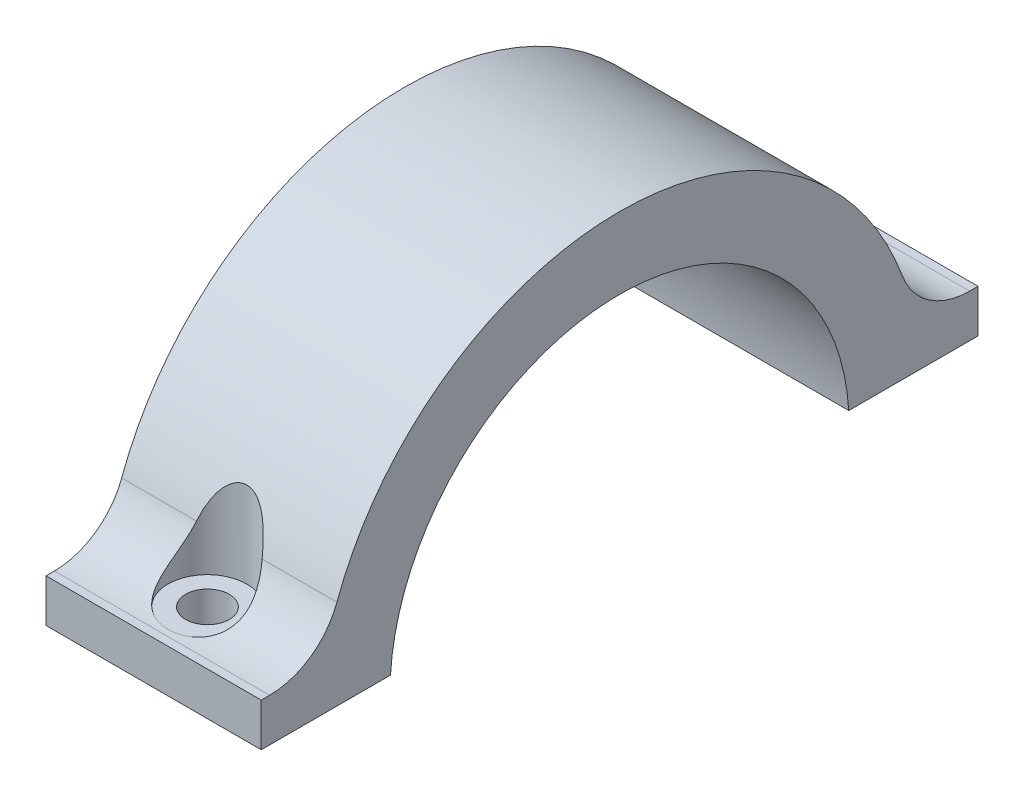
from build123d import *

# Parameters (mm, degrees)
BOSS_EXTRUDE1_DEPTH = 15
FILLET1_R           = 5
SKETCH2_R           = 2.75
CUT_EXTRUDE1_DEPTH  = 34.73143068
CUT_EXTRUDE2_DEPTH  = 34.731430775


# Read off the part's stored shape, not the designer's step: Mirror1
with BuildPart() as part:
    # Sketch1 → Boss-Extrude1 (new body)
    with BuildSketch(Plane(origin=(0, 0, 0), x_dir=(0, 0, -1), z_dir=(1, 0, 0))):
        with BuildLine():
            ThreePointArc((-20.976176963, 1), (-14.491376746, 15.198684154), (0, 21))
            Line((0, 21), (0, 16))
            ThreePointArc((0, 16), (-10.95445115, 11.66190379), (-15.968719423, 1))
            Line((-15.968719423, 1), (-20.976176963, 1))
        make_face()
        with BuildLine():
            Line((-24.976176963, 1), (-20.976176963, 1))
            ThreePointArc((-20.976176963, 1), (-20.84987969, 2.506494942), (-20.615528128, 4))
            Line((-20.615528128, 4), (-24.976176963, 4))
            Line((-24.976176963, 4), (-24.976176963, 1))
        make_face()
    extrude(amount=BOSS_EXTRUDE1_DEPTH)

    # Fillet1
    fillet1_edges = [part.edges().sort_by_distance(p)[0] for p in [
        (7.5, 4, 20.615528128),
    ]]
    fillet(fillet1_edges, radius=FILLET1_R)

    # Sketch2 → Cut-Extrude1 (cut, through all)
    with BuildSketch(Plane(origin=(0, 4, 0), x_dir=(1, 0, 0), z_dir=(0, 1, 0))):
        with Locations(Location((7.5, -21.226176963, 0), (0, 0, 146.334508492))):
            Circle(SKETCH2_R)
    extrude(amount=CUT_EXTRUDE1_DEPTH, mode=Mode.SUBTRACT)

    # Sketch2<3> → Cut-Extrude2 (cut, through all)
    with BuildSketch(Plane(origin=(0, 4, 0), x_dir=(1, 0, 0), z_dir=(0, 1, 0))):
        with BuildLine():
            ThreePointArc((5.975, -21.226176963), (7.5, -22.751176963), (9.025, -21.226176963))
            Line((9.025, -21.226176963), (5.975, -21.226176963))
        make_face()
        with BuildLine():
            Line((5.975, -21.226176963), (9.025, -21.226176963))
            ThreePointArc((9.025, -21.226176963), (7.5, -19.701176963), (5.975, -21.226176963))
        make_face()
    extrude(amount=-CUT_EXTRUDE2_DEPTH, mode=Mode.SUBTRACT)

    # Mirror1: part across plane


with BuildPart() as part_1:
    add(part.part)
    add(part.part.mirror(Plane.XY))


solid = part_1.part
